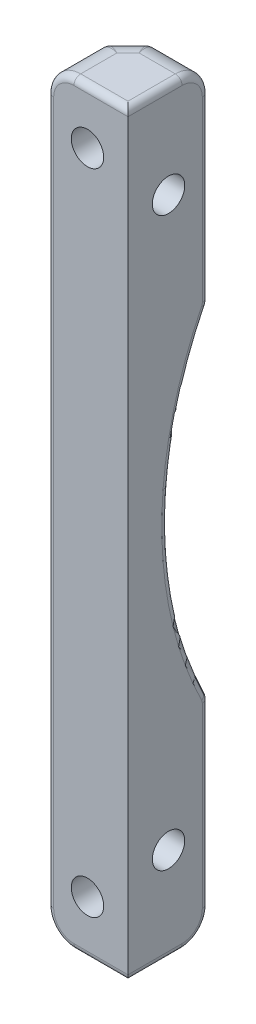
from build123d import *

# Parameters (mm, degrees)
BOSS_EXTRUDE1_DEPTH = 4.7625
SKETCH3_R           = 1.905
CUT_EXTRUDE1_DEPTH  = 46.707871655
SKETCH4_R           = 1.905
CUT_EXTRUDE2_DEPTH  = 47.446245812
CHAMFER1_SIZE       = 3.175
FILLET3_R           = 3.175
FILLET2_R           = 1.5875
FILLET1_R           = 0.79375


with BuildPart() as part:
    # Sketch1 → Boss-Extrude1 (new, symmetric)
    with BuildSketch(Plane(origin=(0, 0, 0), x_dir=(0, 0, -1), z_dir=(1, 0, 0))):
        with BuildLine():
            Line((0, 44.45), (0, -44.45))
            Line((0, -44.45), (9.525, -44.45))
            Line((9.525, -44.45), (9.525, -20.017613338))
            ThreePointArc((9.525, -20.017613338), (4.7625, 0), (9.525, 20.017613338))
            Line((9.525, 20.017613338), (9.525, 44.45))
            Line((9.525, 44.45), (0, 44.45))
        make_face()
    extrude(amount=BOSS_EXTRUDE1_DEPTH, both=True)

    # Sketch3 → Cut-Extrude1 (cut, through all)
    with BuildSketch(Plane.XY):
        with Locations((0, 38.1)):
            Circle(SKETCH3_R)
        with Locations((0, -38.1)):
            Circle(SKETCH3_R)
    extrude(amount=-CUT_EXTRUDE1_DEPTH, mode=Mode.SUBTRACT)

    # Sketch4 → Cut-Extrude2 (cut, through all)
    with BuildSketch(Plane(origin=(4.7625, 0, 0), x_dir=(0, 0, -1), z_dir=(1, 0, 0))):
        with Locations((4.7625, -33.3375)):
            Circle(SKETCH4_R)
        with Locations((4.7625, 33.3375)):
            Circle(SKETCH4_R)
    extrude(amount=-CUT_EXTRUDE2_DEPTH, mode=Mode.SUBTRACT)

    # Chamfer1
    # the kernel refuses this chamfer: 3.175 mm, written as the material it takes off along each edge
    with BuildSketch(Plane(origin=(-4.7625, 11.852519851, -9.525), x_dir=(0.9996219169112966, 0, -0.0274958766105862), z_dir=(0, 1, 0))) as chamfer1_piece_1:
        Polygon((CHAMFER1_SIZE * 0.999621916911, -CHAMFER1_SIZE * 0.0274958766106), (-CHAMFER1_SIZE * 0.0274958766106, -CHAMFER1_SIZE * 0.999621916911), (0, 0), align=None)
    extrude(amount=40.762573636, mode=Mode.SUBTRACT)
    with BuildSketch(Plane(origin=(-4.7625, 0, -49.2125), x_dir=(0, -0.6058738795286908, 0.7955607092515653), z_dir=(0, -0.7955607092515653, -0.6058738795286908))) as chamfer1_piece_2:
        Polygon((44.45 + CHAMFER1_SIZE, 0), (44.45, -CHAMFER1_SIZE), (44.45, 0), align=None)
    revolve(axis=Axis((-4.7625, 0, -49.2125), (-1, 0, 0)), revolution_arc=74.583503673, mode=Mode.SUBTRACT)
    with BuildSketch(Plane(origin=(-4.7625, -52.615093487, -9.525), x_dir=(-0.027495876610586466, 0, 0.9996219169112966), z_dir=(0, 1, 0))) as chamfer1_piece_3:
        Polygon((CHAMFER1_SIZE * 0.999621916911, CHAMFER1_SIZE * 0.0274958766106), (-CHAMFER1_SIZE * 0.0274958766106, CHAMFER1_SIZE * 0.999621916911), (0, 0), align=None)
    extrude(amount=40.762573636, mode=Mode.SUBTRACT)

    # Fillet3
    fillet3_edges = [part.edges().sort_by_distance(p)[0] for p in [
        (1.5875, 44.45, -9.525),
        (1.5875, -44.45, -9.525),
        (-4.7625, 44.45, -3.175),
        (-3.175, -44.45, -7.9375),
        (-3.175, 44.45, -7.9375),
        (-4.7625, -44.45, -3.175),
    ]]
    fillet(fillet3_edges, radius=FILLET3_R)

    # Fillet2
    fillet2_edges = [part.edges().sort_by_distance(p)[0] for p in [
        (1.5875, 20.017613338, -9.525),
    ]]
    fillet(fillet2_edges, radius=FILLET2_R)
    fillet2_2_edges = [part.edges().sort_by_distance(p)[0] for p in [
        (1.5875, -20.017613338, -9.525),
    ]]
    fillet(fillet2_2_edges, radius=FILLET2_R)
    fillet2_3_edges = [part.edges().sort_by_distance(p)[0] for p in [
        (-3.18211477, 20.393468303, -7.93038523),
    ]]
    fillet(fillet2_3_edges, radius=FILLET2_R)
    fillet2_4_edges = [part.edges().sort_by_distance(p)[0] for p in [
        (-3.18211477, -20.393468303, -7.93038523),
    ]]
    fillet(fillet2_4_edges, radius=FILLET2_R)

    # Fillet1
    fillet1_edges = [part.edges().sort_by_distance(p)[0] for p in [
        (4.7625, -30.833403359, -9.525),
        (4.7625, 30.833403359, -9.525),
        (4.7625, 0, -4.7625),
        (-4.7625, 0, 0),
        (4.7625, -20.030762525, -9.483398878),
        (4.7625, 20.030762525, -9.483398878),
        (-4.7625, -26.649837818, -6.35),
        (-4.7625, -20.767066492, -6.322413577),
        (-1.5875, -28.719389174, -9.525),
        (-1.588421179, -20.337733656, -9.524078821),
        (-1.599945154, -20.029214467, -9.483036512),
        (-1.588398845, -19.736080889, -9.383245434),
        (-1.5875, 0, -4.7625),
        (-1.588398841, 19.736080887, -9.383245437),
        (-1.599945154, 20.029214467, -9.483036512),
        (-1.588421179, 20.337733656, -9.524078821),
        (-4.7625, 26.649837818, -6.35),
        (-4.7625, 20.767066492, -6.322413577),
        (-1.5875, 28.719389174, -9.525),
        (-1.5875, 40.214014185, -9.525),
        (-1.5875, -40.214014185, -9.525),
        (-4.7625, -37.832764185, -6.35),
        (-4.7625, 0, -1.5875),
        (-4.7625, 37.832764185, -6.35),
        (-1.183764307, 43.56395682, -8.550295816),
        (-1.183764352, -43.563956717, -8.550295923),
        (-3.787795757, -43.563956876, -5.946264283),
        (-3.787795711, 43.563956921, -5.946264264),
        (4.7625, -44.45, -3.175),
        (4.7625, -43.52006403, -8.59506403),
        (4.7625, 44.45, -3.175),
        (4.7625, 43.52006403, -8.59506403),
        (1.5875, -44.45, 0),
        (-3.83256403, -43.52006403, 0),
        (1.5875, 44.45, 0),
        (-3.83256403, 43.52006403, 0),
    ]]
    fillet(fillet1_edges, radius=FILLET1_R)


solid = part.part
